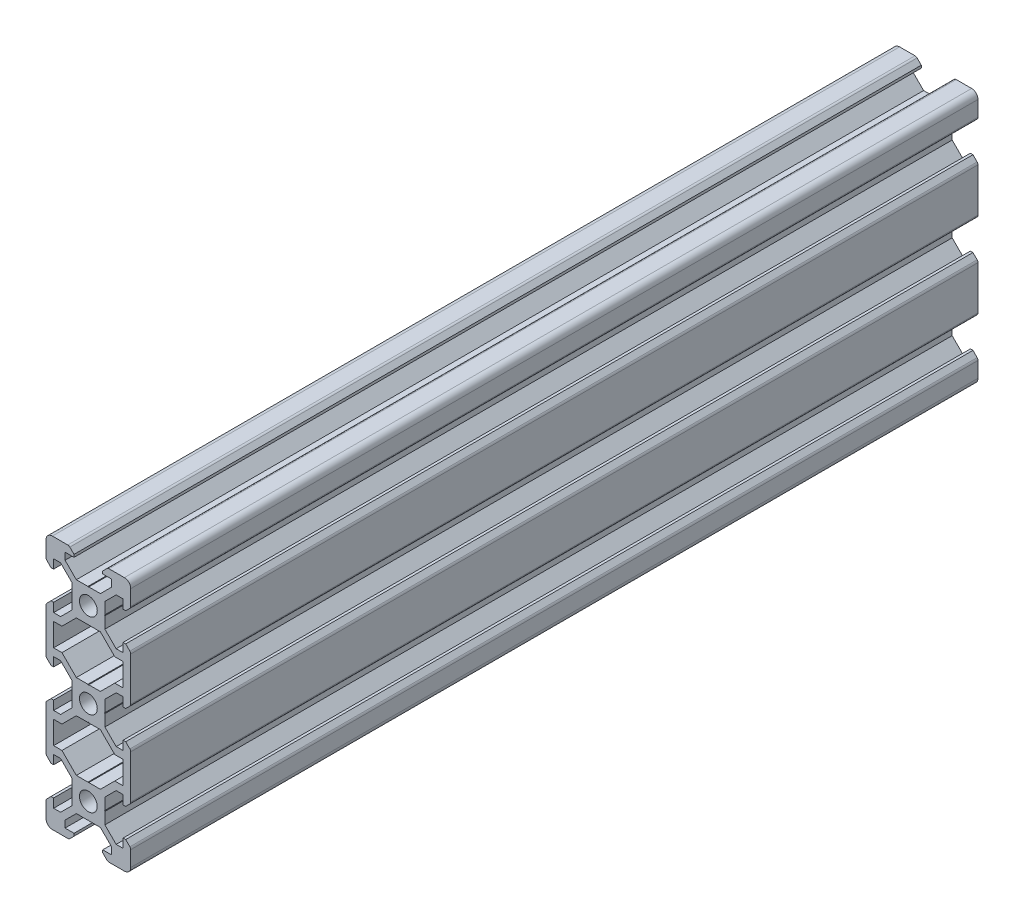
from build123d import *

# Parameters (mm, degrees)
SKETCH1_R           = 2.1
BOSS_EXTRUDE2_DEPTH = 200


with BuildPart() as part:
    # Sketch1 → Boss-Extrude2 (new body)
    with BuildSketch(Plane.XY):
        with BuildLine():
            Line((-8.5, 10), (-4.862792737, 10))
            ThreePointArc((-4.862792737, 10), (-4.598292737, 9.947387679), (-4.374060464, 9.797560464))
            Line((-4.374060464, 9.797560464), (-3.3865, 8.81))
            Line((-3.3865, 8.81), (-3.3865, 8.2))
            Line((-3.3865, 8.2), (-5.5, 8.2))
            Line((-5.5, 8.2), (-5.5, 6.561))
            Line((-5.5, 6.561), (-2.8395, 3.9005))
            Line((-2.8395, 3.9005), (-0.1, 3.9005))
            Line((-0.1, 3.9005), (0, 3.8005))
            Line((0, 3.8005), (0.1, 3.9005))
            Line((0.1, 3.9005), (2.8395, 3.9005))
            Line((2.8395, 3.9005), (5.5, 6.561))
            Line((5.5, 6.561), (5.5, 8.2))
            Line((5.5, 8.2), (3.3865, 8.2))
            Line((3.3865, 8.2), (3.3865, 8.81))
            Line((3.3865, 8.81), (4.374060464, 9.797560464))
            ThreePointArc((4.374060464, 9.797560464), (4.598292737, 9.947387679), (4.862792737, 10))
            Line((4.862792737, 10), (8.5, 10))
            ThreePointArc((8.5, 10), (9.560660172, 9.560660172), (10, 8.5))
            Line((10, 8.5), (10, 4.862792737))
            ThreePointArc((10, 4.862792737), (9.947387679, 4.598292737), (9.797560464, 4.374060464))
            Line((9.797560464, 4.374060464), (8.81, 3.3865))
            Line((8.81, 3.3865), (8.2, 3.3865))
            Line((8.2, 3.3865), (8.2, 5.5))
            Line((8.2, 5.5), (6.561, 5.5))
            Line((6.561, 5.5), (3.9005, 2.8395))
            Line((3.9005, 2.8395), (3.9005, 0.1))
            Line((3.9005, 0.1), (3.8005, 0))
            Line((3.8005, 0), (3.9005, -0.1))
            Line((3.9005, -0.1), (3.9005, -2.8395))
            Line((3.9005, -2.8395), (6.561, -5.5))
            Line((6.561, -5.5), (8.2, -5.5))
            Line((8.2, -5.5), (8.2, -3.3865))
            Line((8.2, -3.3865), (8.81, -3.3865))
            Line((8.81, -3.3865), (9.797560464, -4.374060464))
            ThreePointArc((9.797560464, -4.374060464), (9.947387679, -4.598292737), (10, -4.862792737))
            Line((10, -4.862792737), (10, -15.137207263))
            ThreePointArc((10, -15.137207263), (9.947387679, -15.401707263), (9.797560464, -15.625939536))
            Line((9.797560464, -15.625939536), (8.81, -16.6135))
            Line((8.81, -16.6135), (8.2, -16.6135))
            Line((8.2, -16.6135), (8.2, -14.5))
            Line((8.2, -14.5), (6.561, -14.5))
            Line((6.561, -14.5), (3.9005, -17.1605))
            Line((3.9005, -17.1605), (3.9005, -19.9))
            Line((3.9005, -19.9), (3.8005, -20))
            Line((3.8005, -20), (3.9005, -20.1))
            Line((3.9005, -20.1), (3.9005, -22.8395))
            Line((3.9005, -22.8395), (6.561, -25.5))
            Line((6.561, -25.5), (8.2, -25.5))
            Line((8.2, -25.5), (8.2, -23.3865))
            Line((8.2, -23.3865), (8.81, -23.3865))
            Line((8.81, -23.3865), (9.797560464, -24.374060464))
            ThreePointArc((9.797560464, -24.374060464), (9.947387679, -24.598292737), (10, -24.862792737))
            Line((10, -24.862792737), (10, -35.137207263))
            ThreePointArc((10, -35.137207263), (9.947387679, -35.401707263), (9.797560464, -35.625939536))
            Line((9.797560464, -35.625939536), (8.81, -36.6135))
            Line((8.81, -36.6135), (8.2, -36.6135))
            Line((8.2, -36.6135), (8.2, -34.5))
            Line((8.2, -34.5), (6.561, -34.5))
            Line((6.561, -34.5), (3.9005, -37.1605))
            Line((3.9005, -37.1605), (3.9005, -39.9))
            Line((3.9005, -39.9), (3.8005, -40))
            Line((3.8005, -40), (3.9005, -40.1))
            Line((3.9005, -40.1), (3.9005, -42.8395))
            Line((3.9005, -42.8395), (6.561, -45.5))
            Line((6.561, -45.5), (8.2, -45.5))
            Line((8.2, -45.5), (8.2, -43.3865))
            Line((8.2, -43.3865), (8.81, -43.3865))
            Line((8.81, -43.3865), (9.797560464, -44.374060464))
            ThreePointArc((9.797560464, -44.374060464), (9.947387679, -44.598292737), (10, -44.862792737))
            Line((10, -44.862792737), (10, -48.5))
            ThreePointArc((10, -48.5), (9.560660172, -49.560660172), (8.5, -50))
            Line((8.5, -50), (4.862792737, -50))
            ThreePointArc((4.862792737, -50), (4.598292737, -49.947387679), (4.374060464, -49.797560464))
            Line((4.374060464, -49.797560464), (3.3865, -48.81))
            Line((3.3865, -48.81), (3.3865, -48.2))
            Line((3.3865, -48.2), (5.5, -48.2))
            Line((5.5, -48.2), (5.5, -46.561))
            Line((5.5, -46.561), (2.8395, -43.9005))
            Line((2.8395, -43.9005), (0.1, -43.9005))
            Line((0.1, -43.9005), (0, -43.8005))
            Line((0, -43.8005), (-0.1, -43.9005))
            Line((-0.1, -43.9005), (-2.8395, -43.9005))
            Line((-2.8395, -43.9005), (-5.5, -46.561))
            Line((-5.5, -46.561), (-5.5, -48.2))
            Line((-5.5, -48.2), (-3.3865, -48.2))
            Line((-3.3865, -48.2), (-3.3865, -48.81))
            Line((-3.3865, -48.81), (-4.374060464, -49.797560464))
            ThreePointArc((-4.374060464, -49.797560464), (-4.598292737, -49.947387679), (-4.862792737, -50))
            Line((-4.862792737, -50), (-8.5, -50))
            ThreePointArc((-8.5, -50), (-9.560660172, -49.560660172), (-10, -48.5))
            Line((-10, -48.5), (-10, -44.862792737))
            ThreePointArc((-10, -44.862792737), (-9.947387679, -44.598292737), (-9.797560464, -44.374060464))
            Line((-9.797560464, -44.374060464), (-8.81, -43.3865))
            Line((-8.81, -43.3865), (-8.2, -43.3865))
            Line((-8.2, -43.3865), (-8.2, -45.5))
            Line((-8.2, -45.5), (-6.561, -45.5))
            Line((-6.561, -45.5), (-3.9005, -42.8395))
            Line((-3.9005, -42.8395), (-3.9005, -40.1))
            Line((-3.9005, -40.1), (-3.8005, -40))
            Line((-3.8005, -40), (-3.9005, -39.9))
            Line((-3.9005, -39.9), (-3.9005, -37.1605))
            Line((-3.9005, -37.1605), (-6.561, -34.5))
            Line((-6.561, -34.5), (-8.2, -34.5))
            Line((-8.2, -34.5), (-8.2, -36.6135))
            Line((-8.2, -36.6135), (-8.81, -36.6135))
            Line((-8.81, -36.6135), (-9.797560464, -35.625939536))
            ThreePointArc((-9.797560464, -35.625939536), (-9.947387679, -35.401707263), (-10, -35.137207263))
            Line((-10, -35.137207263), (-10, -24.862792737))
            ThreePointArc((-10, -24.862792737), (-9.947387679, -24.598292737), (-9.797560464, -24.374060464))
            Line((-9.797560464, -24.374060464), (-8.81, -23.3865))
            Line((-8.81, -23.3865), (-8.2, -23.3865))
            Line((-8.2, -23.3865), (-8.2, -25.5))
            Line((-8.2, -25.5), (-6.561, -25.5))
            Line((-6.561, -25.5), (-3.9005, -22.8395))
            Line((-3.9005, -22.8395), (-3.9005, -20.1))
            Line((-3.9005, -20.1), (-3.8005, -20))
            Line((-3.8005, -20), (-3.9005, -19.9))
            Line((-3.9005, -19.9), (-3.9005, -17.1605))
            Line((-3.9005, -17.1605), (-6.561, -14.5))
            Line((-6.561, -14.5), (-8.2, -14.5))
            Line((-8.2, -14.5), (-8.2, -16.6135))
            Line((-8.2, -16.6135), (-8.81, -16.6135))
            Line((-8.81, -16.6135), (-9.797560464, -15.625939536))
            ThreePointArc((-9.797560464, -15.625939536), (-9.947387679, -15.401707263), (-10, -15.137207263))
            Line((-10, -15.137207263), (-10, -4.862792737))
            ThreePointArc((-10, -4.862792737), (-9.947387679, -4.598292737), (-9.797560464, -4.374060464))
            Line((-9.797560464, -4.374060464), (-8.81, -3.3865))
            Line((-8.81, -3.3865), (-8.2, -3.3865))
            Line((-8.2, -3.3865), (-8.2, -5.5))
            Line((-8.2, -5.5), (-6.561, -5.5))
            Line((-6.561, -5.5), (-3.9005, -2.8395))
            Line((-3.9005, -2.8395), (-3.9005, -0.1))
            Line((-3.9005, -0.1), (-3.8005, 0))
            Line((-3.8005, 0), (-3.9005, 0.1))
            Line((-3.9005, 0.1), (-3.9005, 2.8395))
            Line((-3.9005, 2.8395), (-6.561, 5.5))
            Line((-6.561, 5.5), (-8.2, 5.5))
            Line((-8.2, 5.5), (-8.2, 3.3865))
            Line((-8.2, 3.3865), (-8.81, 3.3865))
            Line((-8.81, 3.3865), (-9.797560464, 4.374060464))
            ThreePointArc((-9.797560464, 4.374060464), (-9.947387679, 4.598292737), (-10, 4.862792737))
            Line((-10, 4.862792737), (-10, 8.5))
            ThreePointArc((-10, 8.5), (-9.560660172, 9.560660172), (-8.5, 10))
        make_face()
        Circle(SKETCH1_R, mode=Mode.SUBTRACT)
        with Locations((0, -20)):
            Circle(SKETCH1_R, mode=Mode.SUBTRACT)
        with Locations((0, -40)):
            Circle(SKETCH1_R, mode=Mode.SUBTRACT)
        Polygon((-8.2, -12.7), (-8.2, -7.3), (-6.239, -7.3), (-5.5, -6.561), (-2.8395, -3.9005), (-0.1, -3.9005), (0, -3.8005), (0.1, -3.9005), (2.8395, -3.9005), (5.5, -6.561), (6.239, -7.3), (8.2, -7.3), (8.2, -12.7), (6.239, -12.7), (5.5, -13.439), (2.8395, -16.0995), (0.1, -16.0995), (0, -16.1995), (-0.1, -16.0995), (-2.8395, -16.0995), (-5.5, -13.439), (-6.239, -12.7), align=None, mode=Mode.SUBTRACT)
        Polygon((2.8395, -23.9005), (5.5, -26.561), (6.239, -27.3), (8.2, -27.3), (8.2, -32.7), (6.239, -32.7), (5.5, -33.439), (2.8395, -36.0995), (0.1, -36.0995), (0, -36.1995), (-0.1, -36.0995), (-2.8395, -36.0995), (-5.5, -33.439), (-6.239, -32.7), (-8.2, -32.7), (-8.2, -27.3), (-6.239, -27.3), (-5.5, -26.561), (-2.8395, -23.9005), (-0.1, -23.9005), (0, -23.8005), (0.1, -23.9005), align=None, mode=Mode.SUBTRACT)
    extrude(amount=BOSS_EXTRUDE2_DEPTH)


solid = part.part
